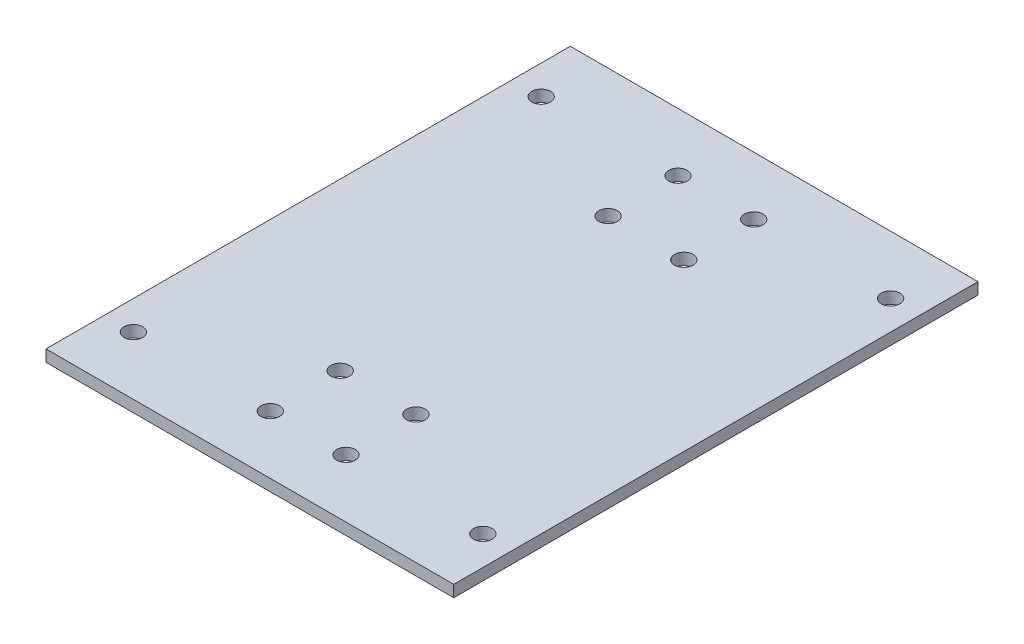
from build123d import *

# Parameters (mm, degrees)
SKETCH_2_W      = 70
SKETCH_2_H      = 90
SKETCH_2_R      = 1.6
EXTRUDE_1_DEPTH = 2


with BuildPart() as part:
    # 草圖2 → 填料-伸長1 (new body)
    with BuildSketch(Plane(origin=(0, 0, 0), x_dir=(1, 0, 0), z_dir=(0, 1, 0))):
        Rectangle(SKETCH_2_W, SKETCH_2_H)
        with Locations((-6.5, 35)):
            Circle(SKETCH_2_R, mode=Mode.SUBTRACT)
        with Locations((-6.5, -35)):
            Circle(SKETCH_2_R, mode=Mode.SUBTRACT)
        with Locations((-6.5, 23)):
            Circle(SKETCH_2_R, mode=Mode.SUBTRACT)
        with Locations((-6.5, -23)):
            Circle(SKETCH_2_R, mode=Mode.SUBTRACT)
        with Locations((6.5, -35)):
            Circle(SKETCH_2_R, mode=Mode.SUBTRACT)
        with Locations((6.5, -23)):
            Circle(SKETCH_2_R, mode=Mode.SUBTRACT)
        with Locations((6.5, 23)):
            Circle(SKETCH_2_R, mode=Mode.SUBTRACT)
        with Locations((6.5, 35)):
            Circle(SKETCH_2_R, mode=Mode.SUBTRACT)
        with Locations((-30, 35)):
            Circle(SKETCH_2_R, mode=Mode.SUBTRACT)
        with Locations((30, 35)):
            Circle(SKETCH_2_R, mode=Mode.SUBTRACT)
        with Locations((-30, -35)):
            Circle(SKETCH_2_R, mode=Mode.SUBTRACT)
        with Locations((30, -35)):
            Circle(SKETCH_2_R, mode=Mode.SUBTRACT)
    extrude(amount=EXTRUDE_1_DEPTH)


solid = part.part
